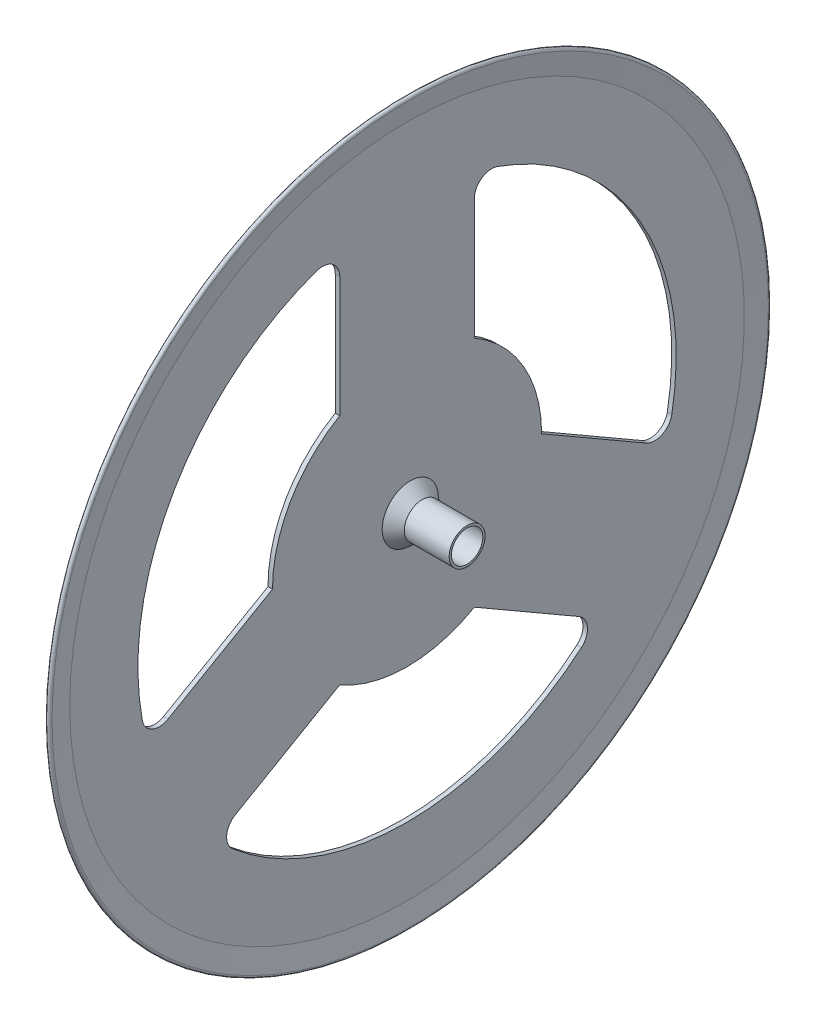
from build123d import *

# Parameters (mm, degrees)
CUT_EXTRUDE1_DEPTH = 114.74253479
SKETCH5_R          = 3.5
CUT_EXTRUDE2_DEPTH = 8


with BuildPart() as part:
    # Sketch1 → Revolve1 (revolve)
    with BuildSketch(Plane.XY):
        with BuildLine():
            Line((-22.400929177, 0), (-22.400929177, 75.270674012))
            Line((-22.400929177, 75.270674012), (-21.683501684, 80))
            ThreePointArc((-21.683501684, 80), (-21.114166433, 80.419353518), (-20.694812916, 79.850018268))
            Line((-20.694812916, 79.850018268), (-21.400929177, 75.195256614))
            Line((-21.400929177, 75.195256614), (-21.400929177, 0))
            Line((-21.400929177, 0), (-22.400929177, 0))
        make_face()
    revolve(axis=Axis((-22.400929177, 0, 0), (1, 0, 0)))

    # Sketch2 → Cut-Extrude1 (cut, through all)
    with BuildSketch(Plane(origin=(-21.400929177, 0, 0), x_dir=(0, 0, -1), z_dir=(1, 0, 0))):
        with BuildLine():
            Line((-15, 25.980762114), (-15, 52.870468111))
            ThreePointArc((-15, 52.870468111), (-16.638004811, 56.029253081), (-20.163544097, 56.510454692))
            ThreePointArc((-20.163544097, 56.510454692), (-51.961524227, 30), (-59.021261391, -10.793085928))
            ThreePointArc((-59.021261391, -10.793085928), (-56.841758929, -13.605691706), (-53.287168494, -13.444852999))
            Line((-53.287168494, -13.444852999), (-30, 0))
            ThreePointArc((-30, 0), (-25.980762114, 15), (-15, 25.980762114))
        make_face()
        with BuildLine():
            Line((15, 52.870468111), (15, 25.980762114))
            ThreePointArc((15, 25.980762114), (25.980762114, 15), (30, 0))
            Line((30, 0), (53.287168494, -13.444852999))
            ThreePointArc((53.287168494, -13.444852999), (56.841758929, -13.605691706), (59.021261391, -10.793085928))
            ThreePointArc((59.021261391, -10.793085928), (51.961524227, 30), (20.163544097, 56.510454692))
            ThreePointArc((20.163544097, 56.510454692), (16.638004811, 56.029253081), (15, 52.870468111))
        make_face()
        with BuildLine():
            ThreePointArc((15, -25.980762114), (0, -30), (-15, -25.980762114))
            Line((-15, -25.980762114), (-38.287168494, -39.425615112))
            ThreePointArc((-38.287168494, -39.425615112), (-40.203754118, -42.423561375), (-38.857717294, -45.717368764))
            ThreePointArc((-38.857717294, -45.717368764), (0, -60), (38.857717294, -45.717368764))
            ThreePointArc((38.857717294, -45.717368764), (40.203754118, -42.423561375), (38.287168494, -39.425615112))
            Line((38.287168494, -39.425615112), (15, -25.980762114))
        make_face()
    extrude(amount=-CUT_EXTRUDE1_DEPTH, mode=Mode.SUBTRACT)


with BuildPart() as body_2:
    # Sketch4 → Revolve2 (revolve)
    with BuildSketch(Plane.XY):
        Polygon((-20.694812916, 6.25493916), (-18.010726755, 4), (-8.010726755, 4), (-8.010726755, 0), (-20.694812916, 0), align=None)
    revolve(axis=Axis((-20.694812916, 0, 0), (1, 0, 0)))

    # Sketch5 → Cut-Extrude2 (cut)
    with BuildSketch(Plane(origin=(-8.010726755, 0, 0), x_dir=(0, 0, -1), z_dir=(1, 0, 0))):
        Circle(SKETCH5_R)
    extrude(amount=-CUT_EXTRUDE2_DEPTH, mode=Mode.SUBTRACT)


solid = Compound([part.part, body_2.part])
